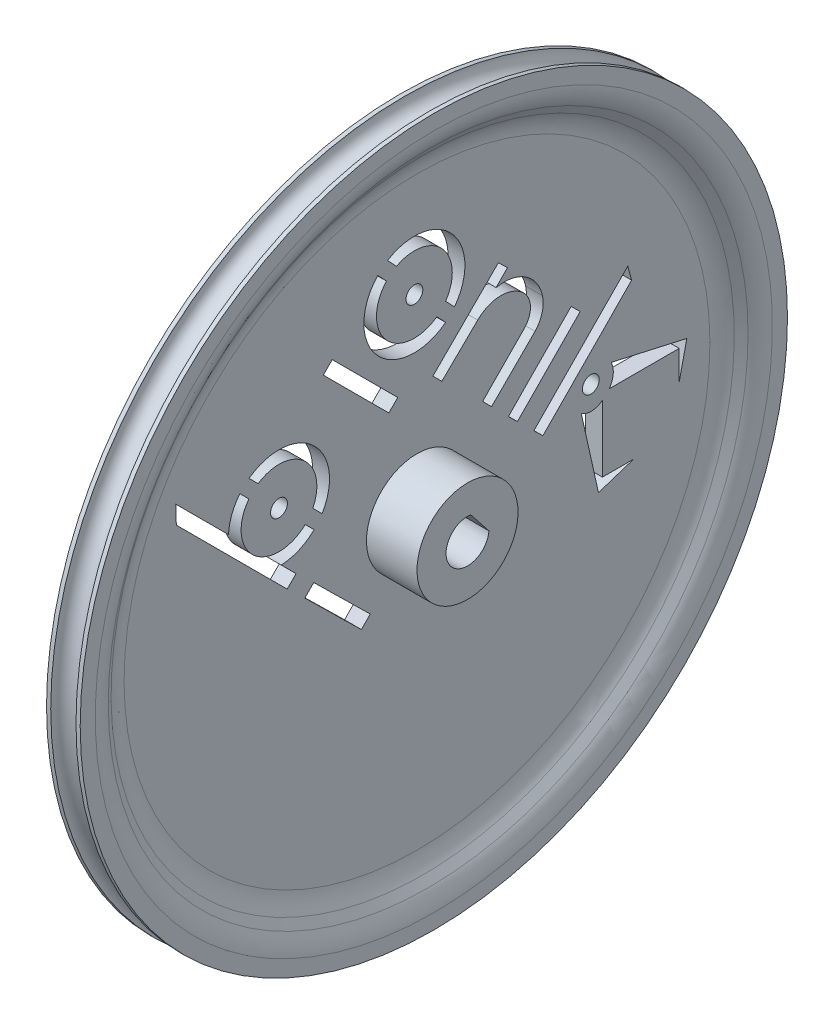
from build123d import *

# Parameters (mm, degrees)
WYTNIJ_WYCI_GNI_CIE8_DEPTH = 70.489061928
SZKIC5_R                   = 1
WYTNIJ_WYCI_GNI_CIE9_DEPTH = 70.287298459


with BuildPart() as part:
    # Szkic1 → Obrót1 (revolve)
    with BuildSketch(Plane.XY):
        with BuildLine():
            Line((6, -12.778916817), (-2, -12.778916817))
            Line((-2, -12.778916817), (-2, 29.221083183))
            Line((-2, 29.221083183), (-1.5, 29.221083183))
            ThreePointArc((-1.5, 29.221083183), (0, 27.721083183), (1.5, 29.221083183))
            Line((1.5, 29.221083183), (2, 29.221083183))
            Line((2, 29.221083183), (2, 27.432185734))
            ThreePointArc((2, 27.432185734), (1.828368106, 26.273049139), (1.328201177, 25.213384949))
            Line((1.328201177, 25.213384949), (0.671798823, 24.228781417))
            ThreePointArc((0.671798823, 24.228781417), (0.171631894, 23.169117227), (0, 22.009980632))
            Line((0, 22.009980632), (0, -6.778916817))
            Line((0, -6.778916817), (6, -6.778916817))
            Line((6, -6.778916817), (6, -12.778916817))
        make_face()
    revolve(axis=Axis((6, -12.778916817, 0), (-1, 0, 0)))

    # Szkic4 → Wytnij-wyciągnięcie8 (cut, through all)
    with BuildSketch(Plane(origin=(6, 0, 0), x_dir=(0, 0, -1), z_dir=(1, 0, 0))):
        with BuildLine():
            Line((0.380948258, -10.257532589), (2.541219296, -12.990351177))
            ThreePointArc((2.541219296, -12.990351177), (-2.000459988, -14.360264293), (0.380948258, -10.257532589))
        make_face()
    extrude(amount=-WYTNIJ_WYCI_GNI_CIE8_DEPTH, mode=Mode.SUBTRACT)

    # Szkic5 → Wytnij-wyciągnięcie9 (cut, through all)
    with BuildSketch(Plane(origin=(0, 0, 0), x_dir=(0, 0, -1), z_dir=(1, 0, 0))):
        with Locations((-16.391059464, -4.176977271)):
            Circle(SZKIC5_R)
        with Locations((-0.310306999, 9.746409569)):
            Circle(SZKIC5_R)
        with Locations((20.64556423, -9.978346818)):
            Circle(SZKIC5_R)
        with BuildLine():
            Line((-28.583324161, 0.162832462), (-15.420491699, -13))
            Line((-15.420491699, -13), (-14.359831527, -11.939339828))
            Line((-14.359831527, -11.939339828), (-16.127965081, -10.171206274))
            ThreePointArc((-16.127965081, -10.171206274), (-14.018087067, -9.687785016), (-12.217043589, -8.487150292))
            Line((-12.217043589, -8.487150292), (-13.277885877, -7.426308004))
            ThreePointArc((-13.277885877, -7.426308004), (-19.389642062, -7.532346461), (-19.968486519, -1.447139241))
            Line((-19.968486519, -1.447139241), (-21.036275326, -0.379350434))
            ThreePointArc((-21.036275326, -0.379350434), (-21.996652803, -2.037509272), (-22.385288467, -3.913882888))
            Line((-22.385288467, -3.913882888), (-28.652886605, 2.353715249))
            Line((-28.652886605, 2.353715249), (-28.583324161, 0.162832462))
        make_face()
        Polygon((-11.124748839, 6.861133254), (-10.064088667, 7.921793426), (-2.285914074, 0.143618833), (-3.346574246, -0.917041339), align=None)
        with BuildLine():
            Line((2.947785282, -0.81145082), (1.88712511, 0.249209351))
            Line((1.88712511, 0.249209351), (9.665299703, 8.027383944))
            Line((9.665299703, 8.027383944), (10.739979901, 6.980931618))
            Line((10.739979901, 6.980931618), (9.396939621, 5.601663057))
            ThreePointArc((9.396939621, 5.601663057), (12.89206776, 4.947545006), (14.900965259, 2.013584889))
            ThreePointArc((14.900965259, 2.013584889), (14.860349326, 0.295383923), (14.020341541, -1.204033009))
            Line((14.020341541, -1.204033009), (8.853434428, -6.370940122))
            Line((8.853434428, -6.370940122), (7.792774256, -5.31027995))
            Line((7.792774256, -5.31027995), (12.723663475, -0.288386106))
            ThreePointArc((12.723663475, -0.288386106), (13.478808972, 1.534696395), (12.723663475, 3.357778897))
            ThreePointArc((12.723663475, 3.357778897), (9.966885654, 4.499673659), (7.210107833, 3.357778897))
            Line((7.210107833, 3.357778897), (2.947785282, -0.81145082))
        make_face()
        Polygon((18.307468228, -0.796920077), (19.377781949, -1.847838028), (11.924414911, -9.438764609), (10.854101191, -8.387846659), align=None)
        Polygon((13.880612543, -11.359512859), (25.028798785, -0.00557539), (25.488220126, -1.678660366), (14.950926264, -12.41043081), align=None)
        Polygon((-13.316002704, -14.97334277), (-12.265084753, -13.903029049), (-5.550061748, -20.496365262), (-6.600979699, -21.566678983), align=None)
        with BuildLine():
            Line((23.069608554, -8.927593887), (32.045063609, -10.951140312))
            Line((32.045063609, -10.951140312), (31.138244584, -14.97334277))
            Line((31.138244584, -14.97334277), (31.138244584, -11.516673821))
            Line((31.138244584, -11.516673821), (22.83575087, -11.516673821))
            ThreePointArc((22.83575087, -11.516673821), (23.304692991, -10.253929323), (23.069608554, -8.927593887))
        make_face()
        with BuildLine():
            Line((19.510201354, -12.408607647), (21.553240257, -21.566678983))
            Line((21.553240257, -21.566678983), (25.71288671, -20.206011619))
            Line((25.71288671, -20.206011619), (22.021558034, -20.206011619))
            Line((22.021558034, -20.206011619), (22.021558034, -12.291045603))
            ThreePointArc((22.021558034, -12.291045603), (20.785458616, -12.768070933), (19.510201354, -12.408607647))
        make_face()
        with BuildLine():
            Line((-11.273580076, -7.309293461), (-12.375270666, -6.207602871))
            ThreePointArc((-12.375270666, -6.207602871), (-13.398417011, -0.816309011), (-18.871789374, -0.422516043))
            Line((-18.871789374, -0.422516043), (-19.948761975, 0.654456558))
            ThreePointArc((-19.948761975, 0.654456558), (-12.333528864, 0.243027869), (-11.273580076, -7.309293461))
        make_face()
        with BuildLine():
            Line((-2.434335401, 13.713587829), (-3.498470338, 14.829284202))
            ThreePointArc((-3.498470338, 14.829284202), (4.126998063, 13.785013757), (4.450847815, 6.095189933))
            Line((4.450847815, 6.095189933), (3.398739047, 7.198277424))
            ThreePointArc((3.398739047, 7.198277424), (3.042361737, 12.7480112), (-2.434335401, 13.713587829))
        make_face()
        with BuildLine():
            Line((-3.625595266, 12.789247671), (-4.662594508, 13.87649352))
            ThreePointArc((-4.662594508, 13.87649352), (-4.746365295, 5.706435956), (3.395900429, 5.027932432))
            Line((3.395900429, 5.027932432), (2.354225826, 6.120080182))
            ThreePointArc((2.354225826, 6.120080182), (-3.66072778, 6.742298954), (-3.625595266, 12.789247671))
        make_face()
    extrude(amount=-WYTNIJ_WYCI_GNI_CIE9_DEPTH, mode=Mode.SUBTRACT)


solid = part.part
